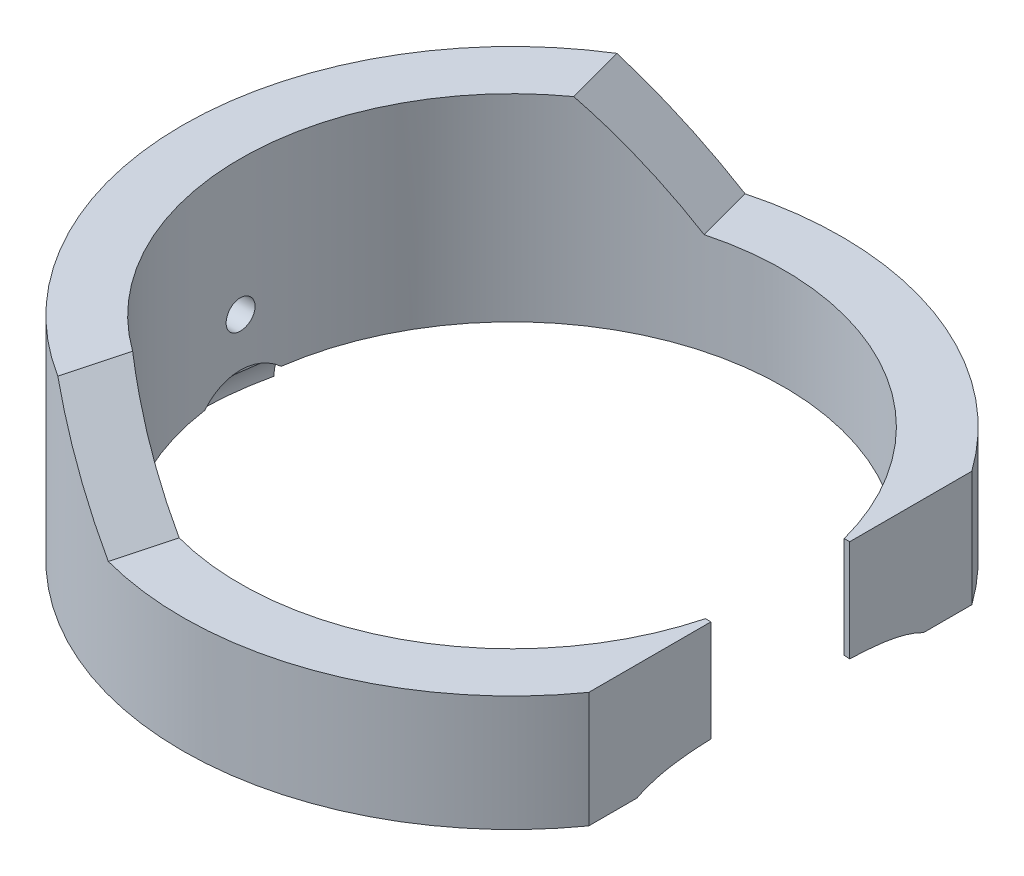
from build123d import *
from build123d.topology import SkipClean

# Parameters (mm, degrees)
CROQUIS1_R                 = 17.1
CROQUIS1_R_2               = 14.1
SALIENTE_EXTRUIR1_DEPTH    = 7.5
CORTAR_EXTRUIR1_REACH      = 30.457
CROQUIS2_W                 = 15.420651877
CROQUIS2_H                 = 7.2
CROQUIS54_W                = 3
CROQUIS54_H                = 25
REVOLUCI_N1_ANGLE          = 150
CORTAR_BARRER2_PROFILE_R   = 2.25
CHAFL_N3_SIZE              = 5
CORTAR_EXTRUIR2_REACH      = 29.223
CORTAR_EXTRUIR2_END_RADIUS = 16.1
CROQUIS61_R                = 3
CORTAR_EXTRUIR3_START      = -17.1
CORTAR_EXTRUIR3_DEPTH      = 33.816758059
CROQUIS63_R                = 0.75
CORTAR_EXTRUIR4_DEPTH      = 10
CROQUIS64_R                = 1.25
CORTAR_EXTRUIR5_DEPTH      = 0.6
CORTAR_EXTRUIR6_START      = -6
CROQUIS65_W                = 2.8
CROQUIS65_H                = 19.872981168
CORTAR_EXTRUIR6_DEPTH      = 11


# Read off the part's stored shape, not the designer's step: Cortar-Extruir3
with BuildPart() as part:
    # Croquis1 → Saliente-Extruir1 (new, symmetric)
    with BuildSketch(Plane(origin=(0, 0, 0), x_dir=(1, 0, 0), z_dir=(0, 1, 0))):
        with Locations(Location((0, 0, 0), (0, 0, 270))):
            Circle(CROQUIS1_R)
        with Locations(Location((0, 0, 0), (0, 0, 270))):
            Circle(CROQUIS1_R_2, mode=Mode.SUBTRACT)
    extrude(amount=SALIENTE_EXTRUIR1_DEPTH, both=True)

    # Croquis2 → Cortar-Extruir1 (cut, up to next)
    with BuildSketch(Plane(origin=(0, 7.5, 0), x_dir=(1, 0, 0), z_dir=(0, 1, 0)), mode=Mode.PRIVATE) as cortar_extruir1_sk1:
        with Locations((15.870282115, 0)):
            Rectangle(CROQUIS2_W, CROQUIS2_H)
    cortar_extruir1_tool1 = extrude(cortar_extruir1_sk1.sketch, amount=-CORTAR_EXTRUIR1_REACH, mode=Mode.PRIVATE) & part.part
    add(cortar_extruir1_tool1.solids().sort_by_distance((15.870282, 7.5, 0))[0], mode=Mode.SUBTRACT)

    # Croquis54 → Revolución1 (revolve, symmetric)
    with SkipClean():  # the faces are left unmerged after this step: merging them gives an invalid solid
        with BuildSketch(Plane.XY) as revoluci_n1_sk:
            with Locations((-15.6, 0)):
                Rectangle(CROQUIS54_W, CROQUIS54_H)
        revolve(axis=Axis((0, -13.582020258, 0), (0, 1, 0)), revolution_arc=REVOLUCI_N1_ANGLE / 2)
        revolve(revoluci_n1_sk.sketch, axis=Axis((0, -13.582020258, 0), (0, -1, 0)), revolution_arc=REVOLUCI_N1_ANGLE / 2)
    add(part.part.scale(1), mode=Mode.REPLACE)  # the faces are merged on a copy

    # Cortar-Barrer2: sweep along a path in Croquis12
    with BuildLine(Plane(origin=(0, 0, 0), x_dir=(1, 0, 0), z_dir=(0, 1, 0))) as cortar_barrer2_path:
        CenterArc((0, 0), 14.1, 0, 360)
    # Cortar-Barrer2 profile (on start of the path) → Cortar-Barrer2 (sweep, cut)
    with BuildSketch(Plane(origin=(14.1, 0, 0), x_dir=(-1, 0, 0), z_dir=(0, 0, -1))):
        Circle(CORTAR_BARRER2_PROFILE_R)
    sweep(path=cortar_barrer2_path.line, mode=Mode.SUBTRACT)

    # Chaflán3
    chafl_n3_edges = [part.edges().sort_by_distance(p)[0] for p in [
        (-4.037577104, -12.5, -15.06844289),
        (-4.037577104, 12.5, -15.06844289),
        (-4.037577104, -12.5, 15.06844289),
        (-4.037577104, 12.5, 15.06844289),
    ]]
    chamfer(chafl_n3_edges, length=CHAFL_N3_SIZE - 0.0001)  # a hair under: the kernel refuses the full size

    # Cortar-Extruir2: up to this cylinder (the profile starts inside it)
    cortar_extruir2_end = Plane(origin=(0, 0, 0), z_dir=(0, -1, 0)) * Cylinder(CORTAR_EXTRUIR2_END_RADIUS, 91.646, mode=Mode.PRIVATE)
    # Croquis61 → Cortar-Extruir2 (cut, up to the surface)
    with BuildSketch(Plane(origin=(0, 0, 0), x_dir=(0, 0, -1), z_dir=(1, 0, 0)), mode=Mode.PRIVATE) as cortar_extruir2_sk1:
        Circle(CROQUIS61_R)
    cortar_extruir2_tool1 = extrude(cortar_extruir2_sk1.sketch, amount=-CORTAR_EXTRUIR2_REACH, mode=Mode.PRIVATE) & cortar_extruir2_end
    add(cortar_extruir2_tool1.solids().sort_by_distance((0, 0, 0))[0], mode=Mode.SUBTRACT)

    # Cortar-Extruir3 outline → Cortar-Extruir3 (cut)
    with BuildSketch(Plane(origin=(0, 0, 0), x_dir=(0, 0, -1), z_dir=(1, 0, 0)).offset(CORTAR_EXTRUIR3_START)):
        Polygon((3.6, 0), (-3.6, 0), (-3.6, 1.5), (-20.692074401, 1.5), (-20.692074401, -12.752391624), (19.353781031, -12.752391624), (19.353781031, 1.5), (3.6, 1.5), align=None)
    extrude(amount=CORTAR_EXTRUIR3_DEPTH, mode=Mode.SUBTRACT)

    # Croquis63 → Cortar-Extruir4 (cut)
    with SkipClean():  # the faces are left unmerged after this step: merging them gives an invalid solid
        with BuildSketch(Plane(origin=(-17.1, 0, 0), x_dir=(0, -1, 0), z_dir=(-1, 0, 0))):
            with Locations(Location((-5.5, 0, 0), (0, 0, 90))):
                Circle(CROQUIS63_R)
        extrude(amount=-CORTAR_EXTRUIR4_DEPTH, mode=Mode.SUBTRACT)

    # Croquis64 → Cortar-Extruir5 (cut)
    with SkipClean():  # the faces are left unmerged after this step: merging them gives an invalid solid
        with BuildSketch(Plane(origin=(-17.1, 0, 0), x_dir=(0, -1, 0), z_dir=(-1, 0, 0))):
            with Locations(Location((-5.5, 0, 0), (0, 0, 90))):
                Circle(CROQUIS64_R)
        extrude(amount=-CORTAR_EXTRUIR5_DEPTH, mode=Mode.SUBTRACT)

    # Croquis65 → Cortar-Extruir6 (cut)
    with SkipClean():  # the faces are left unmerged after this step: merging them gives an invalid solid
        with BuildSketch(Plane(origin=(0, 7.5, 0), x_dir=(1, 0, 0), z_dir=(0, 1, 0)).offset(CORTAR_EXTRUIR6_START)):
            with Locations((15.316758059, 0)):
                Rectangle(CROQUIS65_W, CROQUIS65_H)
        extrude(amount=CORTAR_EXTRUIR6_DEPTH, mode=Mode.SUBTRACT)


solid = part.part
